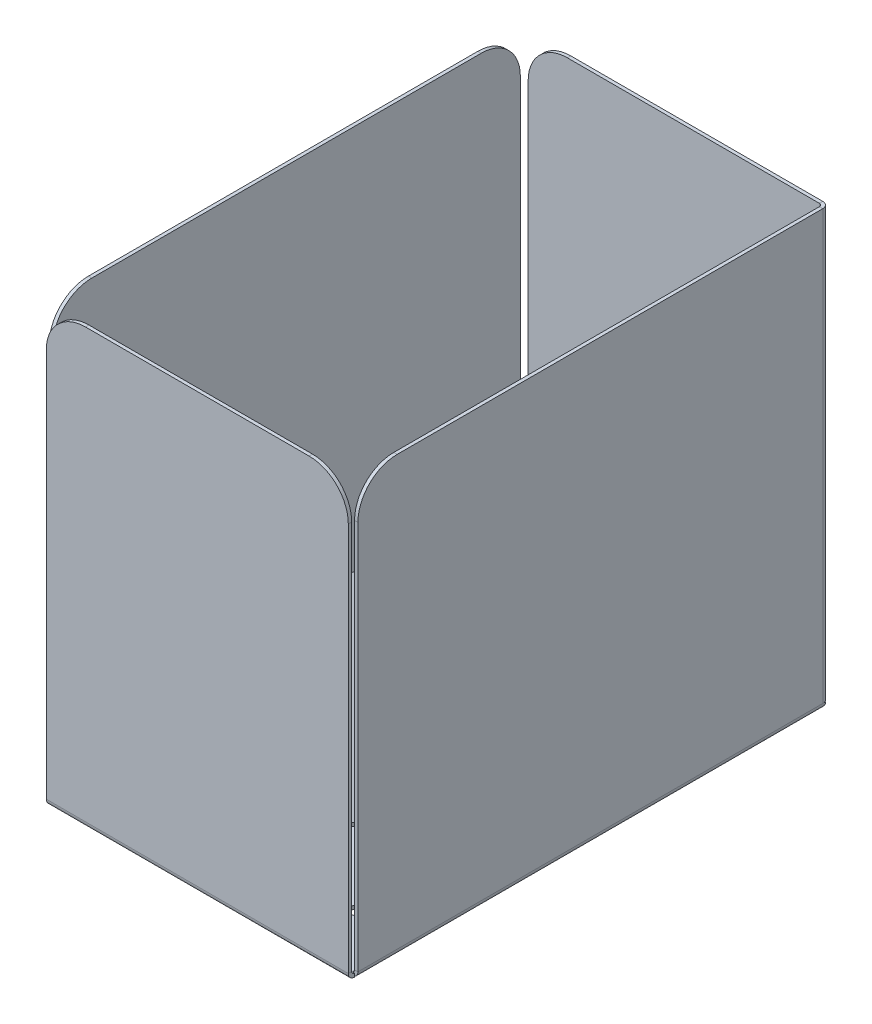
from build123d import *

# Parameters (mm, degrees)
SKETCH1_W                    = 77
SKETCH1_H                    = 120
BASE_FLANGE1_DEPTH           = 0.86
EDGE_FLANGE1_STRIP_W         = 4.9132
EDGE_FLANGE1_STRIP_H         = 0.86
EDGE_FLANGE1_STRIP_CUT_DEPTH = 77
EDGE_FLANGE1_DEPTH           = 77
EDGE_FLANGE2_STRIP_W         = 4.9132
EDGE_FLANGE2_STRIP_H         = 0.86
EDGE_FLANGE2_STRIP_CUT_DEPTH = 119.2634
EDGE_FLANGE2_DEPTH           = 119.2634
EDGE_FLANGE3_STRIP_W         = 4.9132
EDGE_FLANGE3_STRIP_H         = 0.86
EDGE_FLANGE3_STRIP_CUT_DEPTH = 119.2634
EDGE_FLANGE3_DEPTH           = 119.2634
EDGE_FLANGE4_STRIP_CUT_DEPTH = 75.5268
EDGE_FLANGE4_DEPTH           = 75.5268
EDGE_FLANGE8_STRIP_W         = 4.9132
EDGE_FLANGE8_STRIP_H         = 0.86
EDGE_FLANGE8_STRIP_CUT_DEPTH = 109.2634
EDGE_FLANGE8_DEPTH           = 109.2634
M3_CLEARANCE_HOLE3_D         = 3.4
M3_CLEARANCE_HOLE3_DEPTH     = 25.4
M3_CLEARANCE_HOLE3_TIP       = 1.021463052
FILLET1_R                    = 10


# Sheet-metal steps are written as plain solids
with BuildPart() as part:
    # Sketch1 → Base-Flange1 (new body)
    with BuildSketch(Plane(origin=(0, 0, 0), x_dir=(1, 0, 0), z_dir=(0, 1, 0))):
        Rectangle(SKETCH1_W, SKETCH1_H)
    extrude(amount=-BASE_FLANGE1_DEPTH)

    # Edge-Flange1 strip (across the edge) → Edge-Flange1 strip cut (cut)
    with BuildSketch(Plane(origin=(-38.5, 0, 60), x_dir=(0, 0, -1), z_dir=(1, 0, 0))):
        with Locations((-1.72, -0.43)):
            Rectangle(EDGE_FLANGE1_STRIP_W, EDGE_FLANGE1_STRIP_H)
    extrude(amount=EDGE_FLANGE1_STRIP_CUT_DEPTH, mode=Mode.SUBTRACT)

    # Edge-Flange1 section (across the edge) → Edge-Flange1 (add)
    with BuildSketch(Plane(origin=(-38.5, 0, 60), x_dir=(0, 0, -1), z_dir=(1, 0, 0))):
        with BuildLine():
            Line((-0.86, 0.7366), (-0.86, 110))
            Line((-0.86, 110), (0, 110))
            Line((0, 110), (0, 0.7366))
            ThreePointArc((0, 0.7366), (0.215745145, 0.215745145), (0.7366, 0))
            Line((0.7366, 0), (0.7366, -0.86))
            ThreePointArc((0.7366, -0.86), (-0.392366687, -0.392366687), (-0.86, 0.7366))
        make_face()
    extrude(amount=EDGE_FLANGE1_DEPTH)

    # Edge-Flange2 strip (across the edge) → Edge-Flange2 strip cut (cut)
    with BuildSketch(Plane(origin=(38.5, 0, 59.2634), x_dir=(-1, 0, 0), z_dir=(0, 0, -1))):
        with Locations((-1.72, -0.43)):
            Rectangle(EDGE_FLANGE2_STRIP_W, EDGE_FLANGE2_STRIP_H)
    extrude(amount=EDGE_FLANGE2_STRIP_CUT_DEPTH, mode=Mode.SUBTRACT)

    # Edge-Flange2 section (across the edge) → Edge-Flange2 (add)
    with BuildSketch(Plane(origin=(38.5, 0, 59.2634), x_dir=(-1, 0, 0), z_dir=(0, 0, -1))):
        with BuildLine():
            Line((-0.86, 0.7366), (-0.86, 110))
            Line((-0.86, 110), (0, 110))
            Line((0, 110), (0, 0.7366))
            ThreePointArc((0, 0.7366), (0.215745145, 0.215745145), (0.7366, 0))
            Line((0.7366, 0), (0.7366, -0.86))
            ThreePointArc((0.7366, -0.86), (-0.392366687, -0.392366687), (-0.86, 0.7366))
        make_face()
    extrude(amount=EDGE_FLANGE2_DEPTH)

    # Edge-Flange3 strip (across the edge) → Edge-Flange3 strip cut (cut)
    with BuildSketch(Plane(origin=(-38.5, 0, -60), x_dir=(1, 0, 0), z_dir=(0, 0, 1))):
        with Locations((-1.72, -0.43)):
            Rectangle(EDGE_FLANGE3_STRIP_W, EDGE_FLANGE3_STRIP_H)
    extrude(amount=EDGE_FLANGE3_STRIP_CUT_DEPTH, mode=Mode.SUBTRACT)

    # Edge-Flange3 section (across the edge) → Edge-Flange3 (add)
    with BuildSketch(Plane(origin=(-38.5, 0, -60), x_dir=(1, 0, 0), z_dir=(0, 0, 1))):
        with BuildLine():
            Line((-0.86, 0.7366), (-0.86, 110))
            Line((-0.86, 110), (0, 110))
            Line((0, 110), (0, 0.7366))
            ThreePointArc((0, 0.7366), (0.215745145, 0.215745145), (0.7366, 0))
            Line((0.7366, 0), (0.7366, -0.86))
            ThreePointArc((0.7366, -0.86), (-0.392366687, -0.392366687), (-0.86, 0.7366))
        make_face()
    extrude(amount=EDGE_FLANGE3_DEPTH)

    # Edge-Flange4 strip (across the edge) → Edge-Flange4 strip cut (cut)
    with BuildSketch(Plane(origin=(37.7634, 0, -60), x_dir=(0, -0.9659258262890681, 0.25881904510252135), z_dir=(-1, 0, 0))):
        Polygon((-7.380189595, -30.866027382), (2.278797174, 5.181801992), (1.448100964, 5.404386371), (-8.210885806, -30.643443003), align=None)
    extrude(amount=EDGE_FLANGE4_STRIP_CUT_DEPTH, mode=Mode.SUBTRACT)

    # Edge-Flange4 section (across the edge) → Edge-Flange4 (add)
    with BuildSketch(Plane(origin=(37.7634, 0, -60), x_dir=(0, -0.9659258262890681, 0.25881904510252135), z_dir=(-1, 0, 0))):
        with BuildLine():
            Line((-0.86, 5.595032479), (-0.86, 124))
            Line((-0.86, 124), (0, 124))
            Line((0, 124), (0, 5.595032479))
            ThreePointArc((0, 5.595032479), (0.640454407, 4.864734195), (1.448100964, 5.404386371))
            Line((1.448100964, 5.404386371), (2.278797174, 5.181801992))
            ThreePointArc((2.278797174, 5.181801992), (0.528201882, 4.012091614), (-0.86, 5.595032479))
        make_face()
    extrude(amount=EDGE_FLANGE4_DEPTH)

    # Edge-Flange8 strip (across the edge) → Edge-Flange8 strip cut (cut)
    with BuildSketch(Plane(origin=(38.5, 110, -60), x_dir=(0, 0, 1), z_dir=(0, -1, 0))):
        with Locations((-1.72, -0.43)):
            Rectangle(EDGE_FLANGE8_STRIP_W, EDGE_FLANGE8_STRIP_H)
    extrude(amount=EDGE_FLANGE8_STRIP_CUT_DEPTH, mode=Mode.SUBTRACT)

    # Edge-Flange8 section (across the edge) → Edge-Flange8 (add)
    with BuildSketch(Plane(origin=(38.5, 110, -60), x_dir=(0, 0, 1), z_dir=(0, -1, 0))):
        with BuildLine():
            Line((-0.86, 0.7366), (-0.86, 75))
            Line((-0.86, 75), (0, 75))
            Line((0, 75), (0, 0.7366))
            ThreePointArc((0, 0.7366), (0.215745145, 0.215745145), (0.7366, 0))
            Line((0.7366, 0), (0.7366, -0.86))
            ThreePointArc((0.7366, -0.86), (-0.392366687, -0.392366687), (-0.86, 0.7366))
        make_face()
    extrude(amount=EDGE_FLANGE8_DEPTH)

    # M3 Clearance Hole3
    with Locations(Plane(origin=(0, -0.86, 0), x_dir=(-1, 0, 0), z_dir=(0, -1, 0))):
        with Locations((-25, 45), (25, 45), (25, -45), (-25, -45)):
            Hole(M3_CLEARANCE_HOLE3_D / 2, depth=M3_CLEARANCE_HOLE3_DEPTH)
            with Locations((0, 0, -(M3_CLEARANCE_HOLE3_DEPTH + M3_CLEARANCE_HOLE3_TIP / 2))):  # 118° drill point
                Cone(0, M3_CLEARANCE_HOLE3_D / 2, M3_CLEARANCE_HOLE3_TIP, mode=Mode.SUBTRACT)

    # Fillet1
    fillet1_edges = [part.edges().sort_by_distance(p)[0] for p in [
        (-36.5, 0.7366, -60.43),
        (-36.5, 110, -60.43),
        (-38.93, 110, -60),
        (-38.93, 110, 59.2634),
        (38.93, 110, 59.2634),
        (38.5, 110, 60.43),
        (-38.5, 110, 60.43),
    ]]
    fillet(fillet1_edges, radius=FILLET1_R)


solid = part.part
